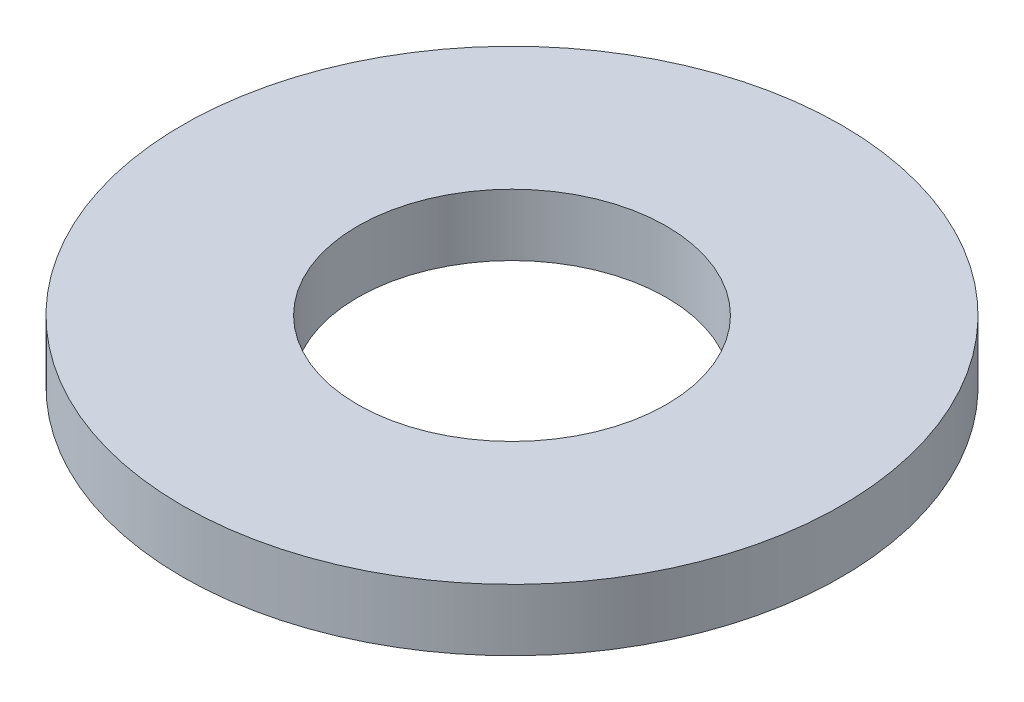
from build123d import *

# Parameters (mm, degrees)
SKETCH1_R           = 80
BOSS_EXTRUDE1_DEPTH = 15
SKETCH2_R           = 37.5
CUT_EXTRUDE1_DEPTH  = 115.127122105


with BuildPart() as part:
    # Sketch1 → Boss-Extrude1 (new body)
    with BuildSketch(Plane(origin=(0, 0, 0), x_dir=(1, 0, 0), z_dir=(0, 1, 0))):
        Circle(SKETCH1_R)
    extrude(amount=BOSS_EXTRUDE1_DEPTH)

    # Sketch2 → Cut-Extrude1 (cut, through all)
    with BuildSketch(Plane(origin=(0, 0, 0), x_dir=(1, 0, 0), z_dir=(0, 1, 0))):
        Circle(SKETCH2_R)
    extrude(amount=CUT_EXTRUDE1_DEPTH, mode=Mode.SUBTRACT)


solid = part.part
